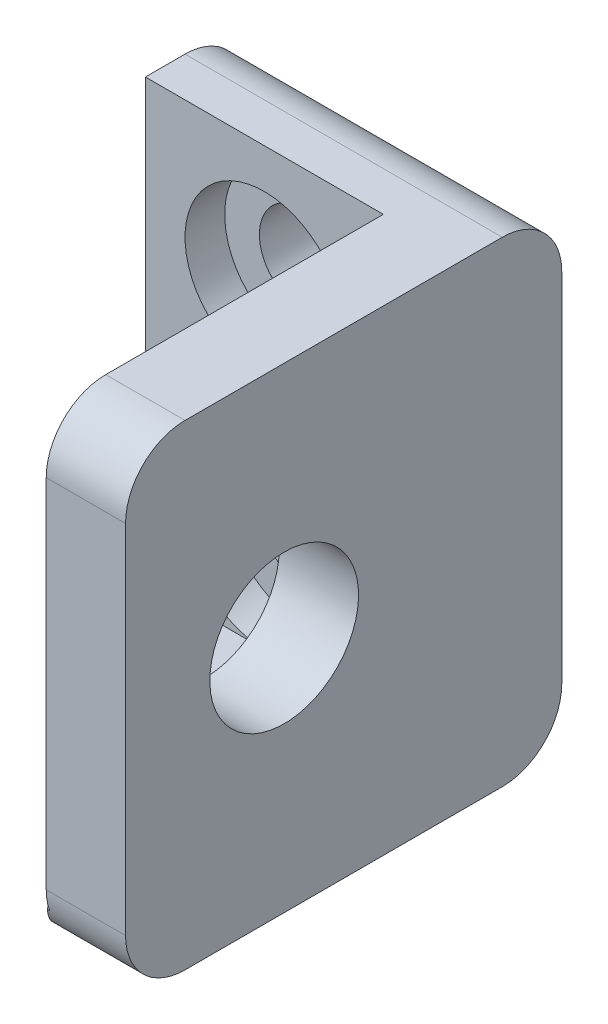
from build123d import *

# Parameters (mm, degrees)
SKETCH1_W                = 16
SKETCH1_H                = 24
SKETCH1_R                = 2.25
BOSS_EXTRUDE1_DEPTH      = 5
BOSS_EXTRUDE2_DEPTH      = 17
BOSS_EXTRUDE2_DEPTH_BACK = 5
SKETCH2_W                = 4
SKETCH2_H                = 24
SKETCH3_R                = 3.75
CUT_EXTRUDE1_DEPTH       = 30.732137495
BOSS_EXTRUDE3_DEPTH      = 2
FILLET1_R                = 3
SKETCH5_R                = 4
CUT_EXTRUDE2_DEPTH       = 2


with BuildPart() as part:
    # Sketch1 → Boss-Extrude1 (new body)
    with BuildSketch(Plane.XY):
        Rectangle(SKETCH1_W, SKETCH1_H)
        with Locations((-2, 6)):
            Circle(SKETCH1_R, mode=Mode.SUBTRACT)
        with Locations((-2, -6)):
            Circle(SKETCH1_R, mode=Mode.SUBTRACT)
    extrude(amount=BOSS_EXTRUDE1_DEPTH)

    # Sketch2 → Boss-Extrude2 (add, two sides: drawn at the far end of the back side and taken through both)
    with BuildSketch(Plane.XY.offset(5).offset(-BOSS_EXTRUDE2_DEPTH_BACK)):
        with Locations((6, 0)):
            Rectangle(SKETCH2_W, SKETCH2_H)
    extrude(amount=BOSS_EXTRUDE2_DEPTH + BOSS_EXTRUDE2_DEPTH_BACK)

    # Sketch3 → Cut-Extrude1 (cut, through all)
    with BuildSketch(Plane(origin=(8, 0, 0), x_dir=(0, 0, -1), z_dir=(1, 0, 0))):
        with Locations(Location((-14, 0, 0), (0, 0, 90))):
            Circle(SKETCH3_R)
    extrude(amount=-CUT_EXTRUDE1_DEPTH, mode=Mode.SUBTRACT)

    # Sketch4 → Boss-Extrude3 (add)
    with BuildSketch(Plane.XZ.offset(12)):
        Polygon((4, 22), (-8, 5), (4, 5), align=None)
    extrude(amount=-BOSS_EXTRUDE3_DEPTH)

    # Fillet1
    # the kernel refuses this fillet: 3 mm, written as the material it takes off along each edge
    with BuildSketch(Plane(origin=(15.5, -12, 22), x_dir=(0, 1, 0), z_dir=(-1, 0, 0))) as fillet1_piece_1:
        with BuildLine():
            CenterArc((FILLET1_R, FILLET1_R), FILLET1_R, 180, 90)
            Line((0, FILLET1_R), (0, 0))
            Line((0, 0), (FILLET1_R, 0))
        make_face()
    extrude(amount=19, mode=Mode.SUBTRACT)
    with BuildSketch(Plane(origin=(-3.5, 12, 22), x_dir=(0, 0, -1), z_dir=(1, 0, 0))) as fillet1_piece_2:
        with BuildLine():
            CenterArc((FILLET1_R, -FILLET1_R), FILLET1_R, 90, 90)
            Line((0, -FILLET1_R), (0, 0))
            Line((0, 0), (FILLET1_R, 0))
        make_face()
    extrude(amount=19, mode=Mode.SUBTRACT)
    with BuildSketch(Plane(origin=(15.5, -12, 0), x_dir=(0, 1, 0), z_dir=(-1, 0, 0)), Plane(origin=(15.5, 12, 0), x_dir=(0, 0, 1), z_dir=(-1, 0, 0))) as fillet1_piece_3:
        with BuildLine():
            CenterArc((FILLET1_R, -FILLET1_R), FILLET1_R, 90, 90)
            Line((0, -FILLET1_R), (0, 0))
            Line((0, 0), (FILLET1_R, 0))
        make_face()
    extrude(amount=31, mode=Mode.SUBTRACT)

    # Sketch5 → Cut-Extrude2 (cut)
    with BuildSketch(Plane.XY.offset(5)):
        with Locations((-2, 6)):
            Circle(SKETCH5_R)
        with Locations((-2, -6)):
            Circle(SKETCH5_R)
    extrude(amount=-CUT_EXTRUDE2_DEPTH, mode=Mode.SUBTRACT)


solid = part.part
